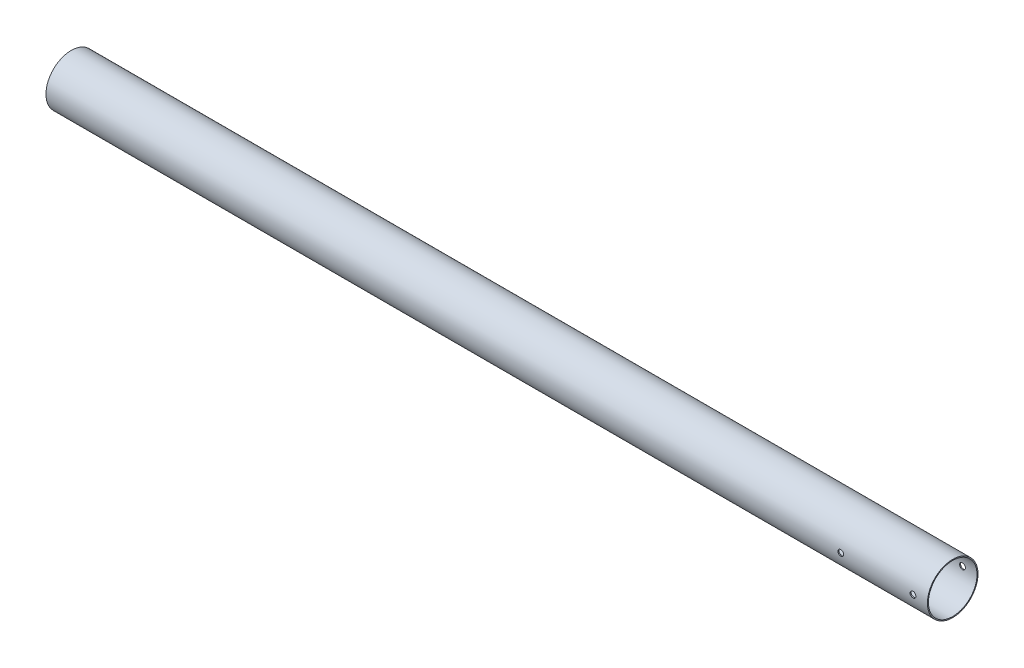
from build123d import *

# Parameters (mm, degrees)
SKETCH3_R               = 22.225
SKETCH3_R_2             = 21.336
BOSS_EXTRUDE1_DEPTH     = 387.35
CUT_EXTRUDE1_DEPTH      = 389.623112733
CUT_EXTRUDE1_DEPTH_BACK = 389.623112733
SKETCH4_R               = 2.5527


with BuildPart() as part:
    # Sketch3 → Boss-Extrude1 (new, symmetric)
    with BuildSketch(Plane(origin=(0, 0, 0), x_dir=(0, 0, -1), z_dir=(1, 0, 0))):
        Circle(SKETCH3_R)
        Circle(SKETCH3_R_2, mode=Mode.SUBTRACT)
    extrude(amount=BOSS_EXTRUDE1_DEPTH, both=True)

    # Sketch4 → Cut-Extrude1 (cut, two sides: drawn at the far end of the back side and taken through both)
    with BuildSketch(Plane.XY.offset(-CUT_EXTRUDE1_DEPTH_BACK)):
        with Locations((311.15, 0)):
            Circle(SKETCH4_R)
        with Locations((374.65, 0)):
            Circle(SKETCH4_R)
    extrude(amount=CUT_EXTRUDE1_DEPTH + CUT_EXTRUDE1_DEPTH_BACK, mode=Mode.SUBTRACT)


solid = part.part
